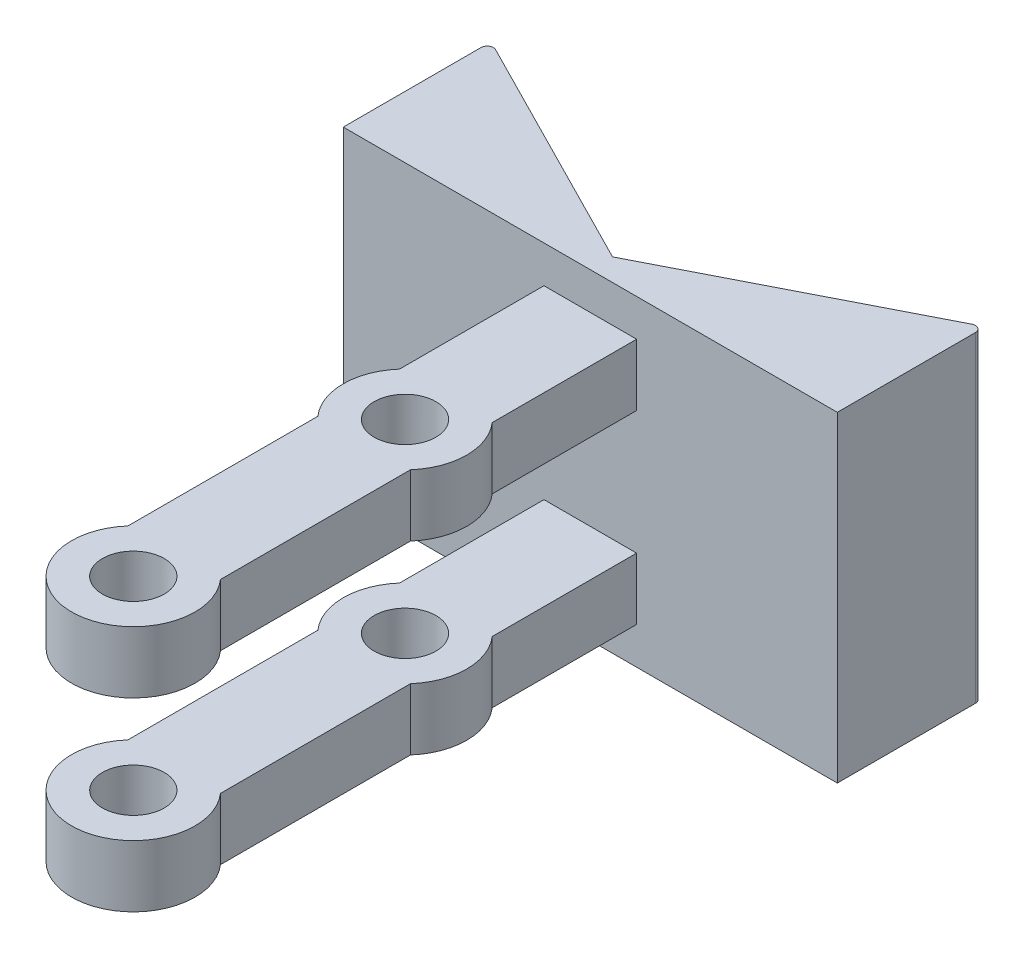
from build123d import *

# Parameters (mm, degrees)
SKETCH1_R               = 2.5
BOSS_EXTRUDE1_DEPTH     = 20
CUT_EXTRUDE1_DEPTH      = 5
CUT_EXTRUDE1_DEPTH_BACK = 5
SKETCH2_W               = 23.75
SKETCH2_H               = 48.430343558
SKETCH3_W               = 40
SKETCH3_H               = 3
BOSS_EXTRUDE2_DEPTH     = 18.668764839
CUT_EXTRUDE2_DEPTH      = 61.919773624
SKETCH5_W               = 6.668765996
SKETCH5_H               = 26
CUT_EXTRUDE3_DEPTH      = 20
FILLET1_R               = 0.5
FILLET3_START           = -4
FILLET3_DEPTH           = 28


with BuildPart() as part:
    # Sketch1 → Boss-Extrude1 (new body)
    with BuildSketch(Plane(origin=(0, 0, 0), x_dir=(1, 0, 0), z_dir=(0, 1, 0))):
        with BuildLine():
            Line((-20, 9.33438242), (20, 9.33438242))
            Line((20, 9.33438242), (20, -9.33438242))
            Line((20, -9.33438242), (3.75, -9.33438242))
            Line((3.75, -9.33438242), (3.75, -21.027193281))
            ThreePointArc((3.75, -21.027193281), (5, -24.33438242), (3.75, -27.641571559))
            Line((3.75, -27.641571559), (3.75, -43.027193281))
            ThreePointArc((3.75, -43.027193281), (0, -51.33438242), (-3.75, -43.027193281))
            Line((-3.75, -43.027193281), (-3.75, -27.641571559))
            ThreePointArc((-3.75, -27.641571559), (-5, -24.33438242), (-3.75, -21.027193281))
            Line((-3.75, -21.027193281), (-3.75, -9.33438242))
            Line((-3.75, -9.33438242), (-20, -9.33438242))
            Line((-20, -9.33438242), (-20, 9.33438242))
        make_face()
        with Locations(Location((0, -24.33438242, 0), (0, 0, 270))):
            Circle(SKETCH1_R, mode=Mode.SUBTRACT)
        with Locations(Location((0, -46.33438242, 0), (0, 0, 270))):
            Circle(SKETCH1_R, mode=Mode.SUBTRACT)
    extrude(amount=BOSS_EXTRUDE1_DEPTH)

    # Sketch2 → Cut-Extrude1 (cut, two sides: drawn at the far end of the back side and taken through both)
    with BuildSketch(Plane(origin=(0, 10, 0), x_dir=(1, 0, 0), z_dir=(0, 1, 0)).offset(-CUT_EXTRUDE1_DEPTH_BACK)):
        with Locations((0, -33.549554199)):
            Rectangle(SKETCH2_W, SKETCH2_H)
    extrude(amount=CUT_EXTRUDE1_DEPTH + CUT_EXTRUDE1_DEPTH_BACK, mode=Mode.SUBTRACT)

    # Sketch3 → Boss-Extrude2 (add)
    with BuildSketch(Plane.XY.offset(9.33438242)):
        with Locations((0, 21.5)):
            Rectangle(SKETCH3_W, SKETCH3_H)
    boss_extrude2 = extrude(amount=-BOSS_EXTRUDE2_DEPTH)

    # Mirror1: Boss-Extrude2 across plane
    add(boss_extrude2.mirror(Plane.ZX.offset(10)))

    # Sketch4 → Cut-Extrude2 (cut, through all)
    with BuildSketch(Plane(origin=(0, 23, 0), x_dir=(1, 0, 0), z_dir=(0, 1, 0))):
        Polygon((-20.060606499, 2.66561758), (0, -7.53438242), (19.99607118, 2.66561758), (20, 9.33438242), (-20, 9.33438242), align=None)
    extrude(amount=-CUT_EXTRUDE2_DEPTH, mode=Mode.SUBTRACT)

    # Sketch5 → Cut-Extrude3 (cut)
    with BuildSketch(Plane(origin=(19.994493824, 0, 0.011779509), x_dir=(-0.0005891375272774049, 0, 0.999999826458472), z_dir=(-0.9999998264584721, 0, -0.0005891375272774049))):
        with Locations((-6.011780552, 10)):
            Rectangle(SKETCH5_W, SKETCH5_H)
    extrude(amount=-CUT_EXTRUDE3_DEPTH, mode=Mode.SUBTRACT)

    # Fillet1
    # the kernel refuses this fillet: 0.5 mm, written as the material it takes off along each edge
    with BuildSketch(Plane(origin=(-20, -5.037877222, -2.634801648), x_dir=(0, 0, 1), z_dir=(0, 1, 0))) as fillet1_piece_1:
        with BuildLine():
            CenterArc((FILLET1_R * 1.6303017777, FILLET1_R), FILLET1_R, 153.048520929, 116.951479071)
            Line((FILLET1_R * 0.738911111215, FILLET1_R * 1.4532357882), (0, 0))
            Line((0, 0), (FILLET1_R * 1.6303017777, 0))
        make_face()
    extrude(amount=30.075754444, mode=Mode.SUBTRACT)
    with BuildSketch(Plane(origin=(20, 23.156386842, -2.665615266), x_dir=(0, 0, 1), z_dir=(0, -1, 0))) as fillet1_piece_2:
        with BuildLine():
            CenterArc((0.062554737, 0.5), FILLET1_R, 262.81265488, 7.18734512)
            Line((-2.315e-06, 0.00392882), (0, 0))
            Line((0, 0), (0.062554737, 0))
        make_face()
    extrude(amount=26.312773684, mode=Mode.SUBTRACT)

    # Fillet3: read off the stored shape, not the designer's step
    # Fillet3 outline → Fillet3 (cut)
    with BuildSketch(Plane(origin=(0, 0, 0), x_dir=(1, 0, 0), z_dir=(0, 1, 0)).offset(FILLET3_START)):
        with BuildLine():
            ThreePointArc((19.272801541, 2.296677589), (19.761152035, 2.277657587), (20, 1.851277926))
            Line((20, 1.851277926), (20, 2.603060529))
            ThreePointArc((20, 2.603060529), (19.999016828, 2.63440068), (19.99607118, 2.66561758))
            Line((19.99607118, 2.66561758), (19.272801541, 2.296677589))
        make_face()
    extrude(amount=FILLET3_DEPTH, mode=Mode.SUBTRACT)


solid = part.part
